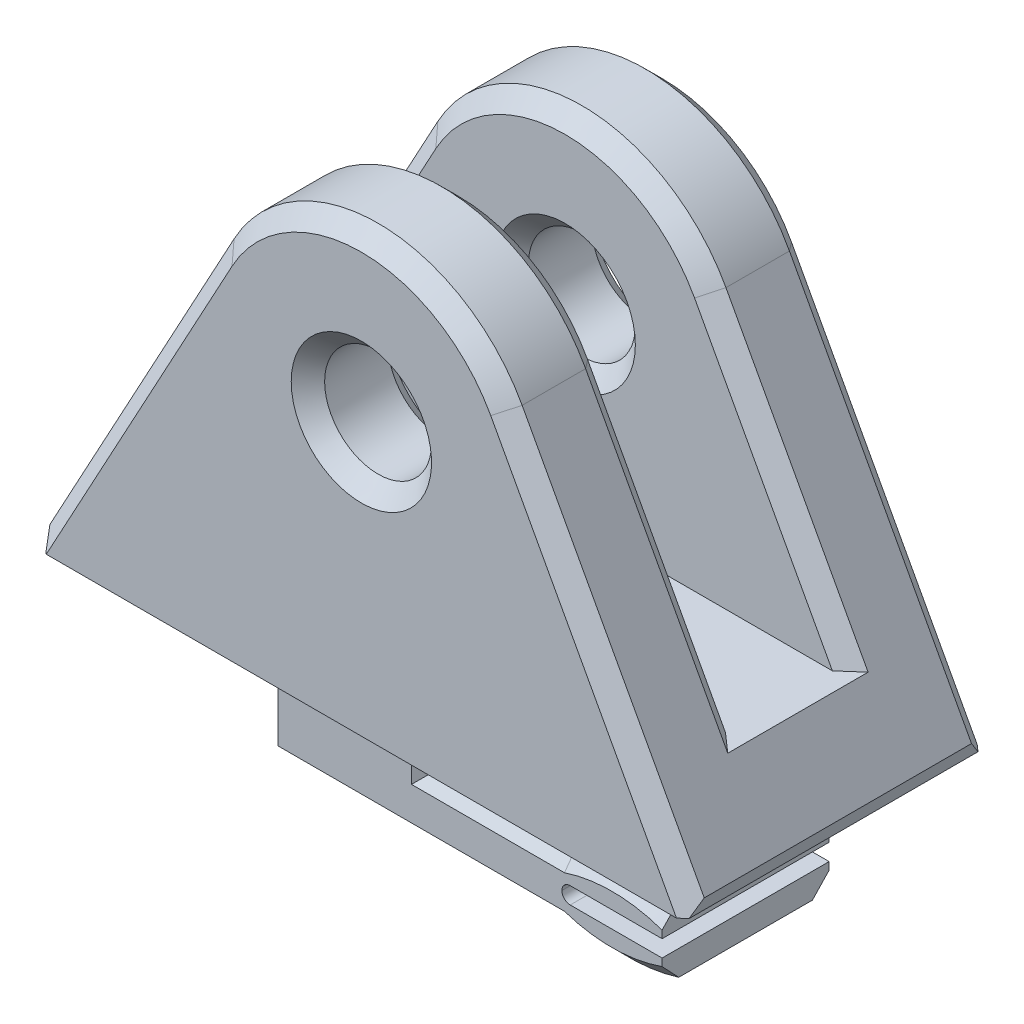
from build123d import *
from OCP.BRepFilletAPI import BRepFilletAPI_MakeChamfer

# Parameters (mm, degrees)
BOSS_EXTRUDE1_DEPTH      = 4.5
BOSS_EXTRUDE1_DEPTH_BACK = 4.5
CUT_EXTRUDE1_START       = -6.1
CUT_EXTRUDE1_DEPTH       = 3.2
CUT_EXTRUDE2_DEPTH       = 19.277658975
CUT_EXTRUDE2_DEPTH_BACK  = 19.277658975
SKETCH3_R                = 1.6
SKETCH4_W                = 20
SKETCH4_H                = 4.97497426
CUT_EXTRUDE3_DEPTH       = 2
SKETCH5_W                = 20
SKETCH5_H                = 5.22601356
CUT_EXTRUDE4_DEPTH       = 2
FILLET1_R                = 0.25
CHAMFER1_SIZE            = 0.5
CHAMFER1_SIZE2           = 0.368761208
CHAMFER2_SIZE            = 0.5


with BuildPart() as part:
    # Sketch1 → Boss-Extrude1 (new, two sides: drawn at the far end of the back side and taken through both)
    with BuildSketch(Plane.XY.offset(-BOSS_EXTRUDE1_DEPTH_BACK)):
        with BuildLine():
            Line((-10, -8.141956011), (-4.311694326, 2.339879755))
            ThreePointArc((-4.311694326, 2.339879755), (0, 4.905684991), (4.311694326, 2.339879755))
            Line((4.311694326, 2.339879755), (10, -8.141956011))
            Line((10, -8.141956011), (0, -8.141956011))
            Line((0, -8.141956011), (0, -10.141956011))
            Line((0, -10.141956011), (4, -10.141956011))
            ThreePointArc((4, -10.141956011), (5.5, -9.911652018), (7, -10.141956011))
            Line((7, -10.141956011), (7, -10.891956011))
            Line((7, -10.891956011), (4, -10.891956011))
            Line((4, -10.891956011), (4, -11.391956011))
            Line((4, -11.391956011), (7, -11.391956011))
            Line((7, -11.391956011), (7, -12.141956011))
            ThreePointArc((7, -12.141956011), (5.5, -12.372260004), (4, -12.141956011))
            Line((4, -12.141956011), (-5, -12.141956011))
            Line((-5, -12.141956011), (-5, -8.141956011))
            Line((-5, -8.141956011), (-10, -8.141956011))
        make_face()
    extrude(amount=BOSS_EXTRUDE1_DEPTH + BOSS_EXTRUDE1_DEPTH_BACK)

    # Sketch2 → Cut-Extrude1 (cut)
    with BuildSketch(Plane.XY.offset(4.5).offset(CUT_EXTRUDE1_START)):
        with BuildLine():
            Line((8.566257505, -5.5), (4.311694326, 2.339879755))
            ThreePointArc((4.311694326, 2.339879755), (0, 4.905684991), (-4.311694326, 2.339879755))
            Line((-4.311694326, 2.339879755), (-8.566257505, -5.5))
            Line((-8.566257505, -5.5), (8.566257505, -5.5))
        make_face()
    extrude(amount=CUT_EXTRUDE1_DEPTH, mode=Mode.SUBTRACT)

    # Sketch3 → Cut-Extrude2 (cut, two sides: drawn at the far end of the back side and taken through both)
    with BuildSketch(Plane.XY.offset(4.5).offset(-CUT_EXTRUDE2_DEPTH_BACK)):
        Circle(SKETCH3_R)
    extrude(amount=CUT_EXTRUDE2_DEPTH + CUT_EXTRUDE2_DEPTH_BACK, mode=Mode.SUBTRACT)

    # Sketch4 → Cut-Extrude3 (cut)
    with BuildSketch(Plane.XY.offset(4.5)):
        with Locations((0, -10.629443141)):
            Rectangle(SKETCH4_W, SKETCH4_H)
    extrude(amount=-CUT_EXTRUDE3_DEPTH, mode=Mode.SUBTRACT)

    # Sketch5 → Cut-Extrude4 (cut)
    with BuildSketch(Plane(origin=(0, 0, -4.5), x_dir=(-1, 0, 0), z_dir=(0, 0, -1))):
        with Locations((0, -10.754962791)):
            Rectangle(SKETCH5_W, SKETCH5_H)
    extrude(amount=-CUT_EXTRUDE4_DEPTH, mode=Mode.SUBTRACT)

    # Fillet1
    fillet1_edges = [part.edges().sort_by_distance(p)[0] for p in [
        (4, -11.391956011, 0),
        (4, -10.891956011, 0),
    ]]
    fillet(fillet1_edges, radius=FILLET1_R - 0.0001)  # a hair under: the kernel refuses the full size

    # Chamfer1: one chamfer whose edges measure the first distance from different faces: ONE call of the kernel's chamfer builder (chamfer() names one face for all edges)
    chamfer1_edges_1 = [part.edges().sort_by_distance(p)[0] for p in [
        (-10, -8.141956011, 0),
    ]]
    chamfer1_side_1 = [part.faces().sort_by_distance(p)[0] for p in [
        (0.403225806, -8.141956011, 0),
    ]]
    chamfer1_edges_2 = [part.edges().sort_by_distance(p)[0] for p in [
        (10, -8.141956011, 0),
    ]]
    chamfer1_side_2 = [part.faces().sort_by_distance(p)[0] for p in [
        (4.382957635, 2.20856292, 3.05),
    ]]
    chamfer1_edges_3 = [part.edges().sort_by_distance(p)[0] for p in [
        (7.155847163, -2.901038128, -4.5),
        (0, 4.905684991, -4.5),
        (7.155847163, -2.901038128, 4.5),
        (0, 4.905684991, 4.5),
        (-7.155847163, -2.901038128, 4.5),
        (-7.155847163, -2.901038128, -4.5),
        (0, 4.905684991, -1.6),
        (6.438975915, -1.580060123, -1.6),
        (-6.438975915, -1.580060123, -1.6),
        (0, 4.905684991, 1.6),
        (-6.438975915, -1.580060123, 1.6),
        (6.438975915, -1.580060123, 1.6),
        (-1.6, 0, 1.6),
        (-1.6, 0, 4.5),
        (-1.6, 0, -1.6),
        (-1.6, 0, -4.5),
    ]]
    chamfer1 = BRepFilletAPI_MakeChamfer(part.part.solid().wrapped)
    for e in chamfer1_edges_1:
        chamfer1.Add(CHAMFER1_SIZE, CHAMFER1_SIZE2, e.wrapped, chamfer1_side_1[0].wrapped)  # the first distance lies on this face
    for e in chamfer1_edges_2:
        chamfer1.Add(CHAMFER1_SIZE, CHAMFER1_SIZE2, e.wrapped, chamfer1_side_2[0].wrapped)  # the first distance lies on this face
    for e in chamfer1_edges_3:
        chamfer1.Add(CHAMFER1_SIZE, e.wrapped)
    add(Compound.cast(chamfer1.Shape()), mode=Mode.REPLACE)

    # Chamfer2
    chamfer2_edges = [part.edges().sort_by_distance(p)[0] for p in [
        (-5, -10.141956011, 2.5),
        (0, -9.141956011, 2.5),
        (2, -10.141956011, 2.5),
        (5.5, -9.911652018, 2.5),
        (5.5, -12.372260004, 2.5),
        (-0.5, -12.141956011, 2.5),
        (-5, -12.141956011, 0),
        (0, -9.141956011, -2.5),
        (2, -10.141956011, -2.5),
        (5.5, -9.911652018, -2.5),
        (5.5, -12.372260004, -2.5),
        (-0.5, -12.141956011, -2.5),
        (-5, -10.141956011, -2.5),
    ]]
    chamfer(chamfer2_edges, length=CHAMFER2_SIZE)


solid = part.part
